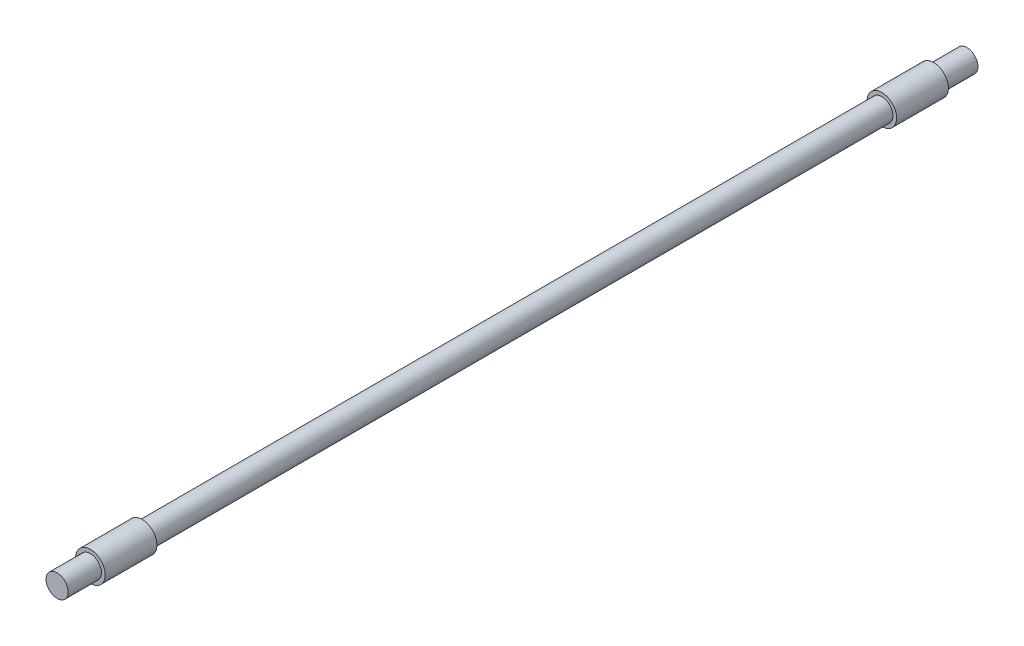
from build123d import *

# Parameters (mm, degrees)
SKETCH1_R           = 15
BOSS_EXTRUDE1_DEPTH = 1000
SKETCH2_R           = 20
BOSS_EXTRUDE2_DEPTH = 70
SKETCH3_R           = 15
BOSS_EXTRUDE3_DEPTH = 45
BOSS_EXTRUDE4_START = 70
SKETCH4_R           = 20
BOSS_EXTRUDE4_DEPTH = 70
BOSS_EXTRUDE5_START = 45
SKETCH5_R           = 15
BOSS_EXTRUDE5_DEPTH = 45


with BuildPart() as part:
    # Sketch1 → Boss-Extrude1 (new body)
    with BuildSketch(Plane.XY):
        Circle(SKETCH1_R)
    extrude(amount=BOSS_EXTRUDE1_DEPTH)

    # Sketch2 → Boss-Extrude2 (add)
    with BuildSketch(Plane.XY.offset(1000)):
        Circle(SKETCH2_R)
    extrude(amount=BOSS_EXTRUDE2_DEPTH)

    # Sketch3 → Boss-Extrude3 (add)
    with BuildSketch(Plane.XY.offset(1070)):
        Circle(SKETCH3_R)
    extrude(amount=BOSS_EXTRUDE3_DEPTH)

    # Sketch4 → Boss-Extrude4 (add)
    with BuildSketch(Plane(origin=(0, 0, 0), x_dir=(-1, 0, 0), z_dir=(0, 0, -1)).offset(BOSS_EXTRUDE4_START)):
        Circle(SKETCH4_R)
    extrude(amount=-BOSS_EXTRUDE4_DEPTH)

    # Sketch5 → Boss-Extrude5 (add)
    with BuildSketch(Plane(origin=(0, 0, -70), x_dir=(-1, 0, 0), z_dir=(0, 0, -1)).offset(BOSS_EXTRUDE5_START)):
        Circle(SKETCH5_R)
    extrude(amount=-BOSS_EXTRUDE5_DEPTH)


solid = part.part
